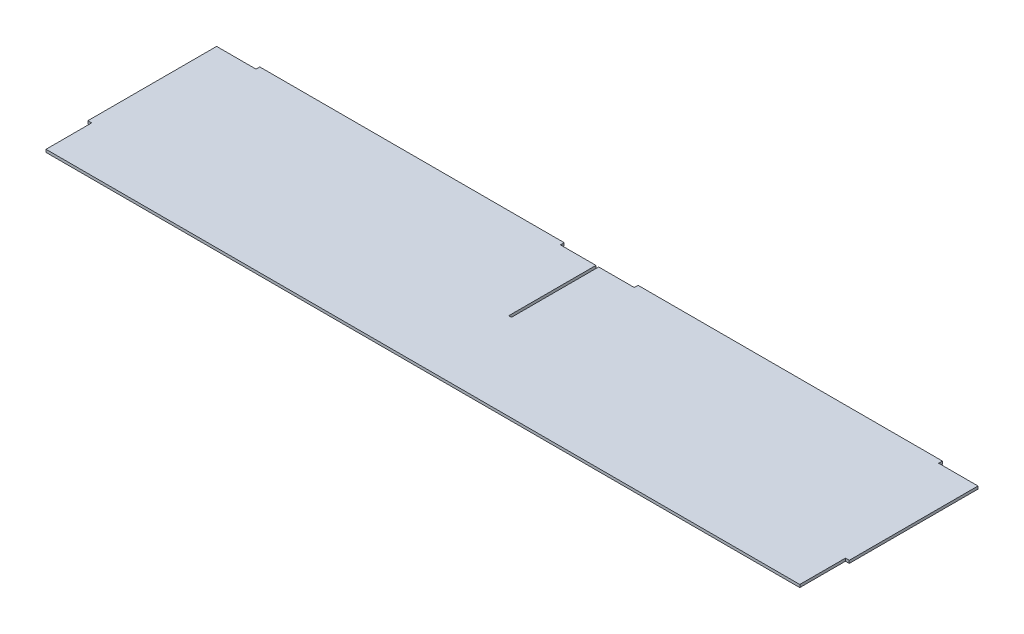
from build123d import *

# Parameters (mm, degrees)
SKETCH1_W           = 635.3556
SKETCH1_H           = 145.542
BOSS_EXTRUDE1_DEPTH = 1.143
SKETCH2_W           = 254
SKETCH2_H           = 2.286
BOSS_EXTRUDE2_DEPTH = 3.175
SKETCH3_W           = 3.175
SKETCH3_H           = 38.1
CUT_EXTRUDE1_DEPTH  = 327.637727957
SKETCH4_W           = 2.286
SKETCH4_H           = 72.771
CUT_EXTRUDE2_DEPTH  = 327.637727957


with BuildPart() as part:
    # Sketch1 → Boss-Extrude1 (new, symmetric)
    with BuildSketch(Plane(origin=(0, 0, 0), x_dir=(1, 0, 0), z_dir=(0, 1, 0))):
        Rectangle(SKETCH1_W, SKETCH1_H)
    extrude(amount=BOSS_EXTRUDE1_DEPTH, both=True)

    # Sketch2 → Boss-Extrude2 (add)
    with BuildSketch(Plane(origin=(0, 0, -72.771), x_dir=(-1, 0, 0), z_dir=(0, 0, -1))):
        with Locations((-157.8229, 0)):
            Rectangle(SKETCH2_W, SKETCH2_H)
        with Locations((157.8229, 0)):
            Rectangle(SKETCH2_W, SKETCH2_H)
    extrude(amount=BOSS_EXTRUDE2_DEPTH)

    # Sketch3 → Cut-Extrude1 (cut, through all)
    with BuildSketch(Plane.XZ.offset(1.143)):
        with Locations((-316.0903, 53.721)):
            Rectangle(SKETCH3_W, SKETCH3_H)
    cut_extrude1 = extrude(amount=-CUT_EXTRUDE1_DEPTH, mode=Mode.SUBTRACT)

    # Mirror1: Cut-Extrude1 across plane
    add(cut_extrude1.mirror(Plane(origin=(0, 0, 0), x_dir=(0, 0, 1), z_dir=(1, 0, 0))), mode=Mode.SUBTRACT)

    # Sketch4 → Cut-Extrude2 (cut, through all)
    with BuildSketch(Plane.XZ.offset(1.143)):
        with Locations((0, -36.3855)):
            Rectangle(SKETCH4_W, SKETCH4_H)
    extrude(amount=-CUT_EXTRUDE2_DEPTH, mode=Mode.SUBTRACT)


solid = part.part
